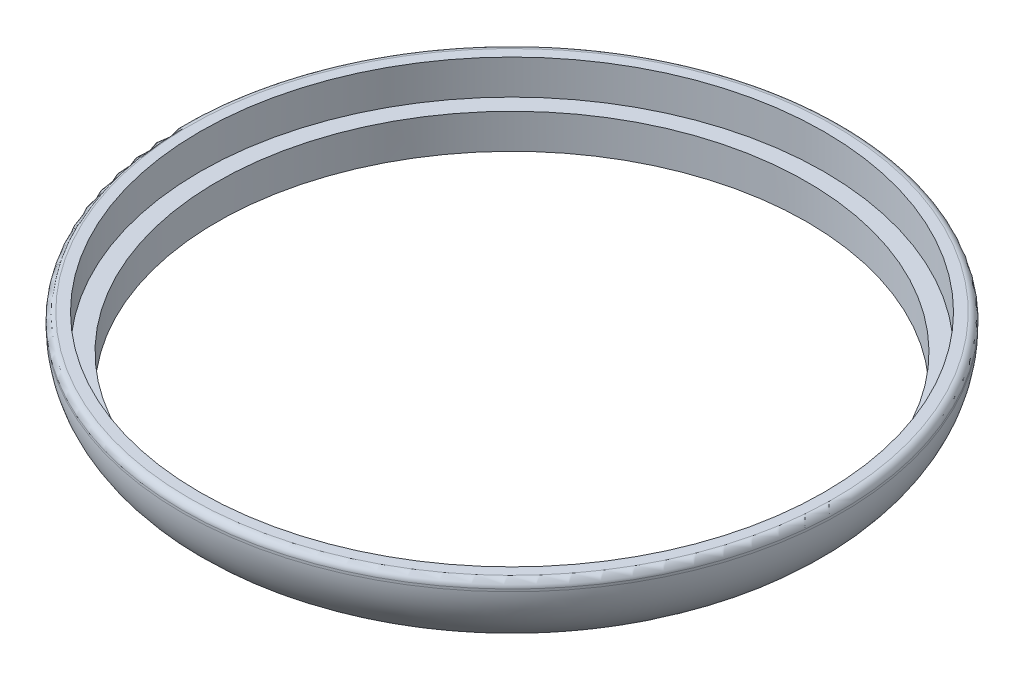
from build123d import *

# Parameters (mm, degrees)
SKETCH1_R           = 4.75
SKETCH1_R_2         = 4.25
BOSS_EXTRUDE1_DEPTH = 1
SKETCH2_R           = 4.5
CUT_EXTRUDE1_DEPTH  = 0.5
FILLET1_R           = 1
FILLET2_R           = 0.1


with BuildPart() as part:
    # Sketch1 → Boss-Extrude1 (new body)
    with BuildSketch(Plane(origin=(0, 0, 0), x_dir=(1, 0, 0), z_dir=(0, 1, 0))):
        with Locations(Location((0, 0, 0), (0, 0, 270))):
            Circle(SKETCH1_R)
        with Locations(Location((0, 0, 0), (0, 0, 270))):
            Circle(SKETCH1_R_2, mode=Mode.SUBTRACT)
    extrude(amount=BOSS_EXTRUDE1_DEPTH)

    # Sketch2 → Cut-Extrude1 (cut)
    with BuildSketch(Plane(origin=(0, 1, 0), x_dir=(1, 0, 0), z_dir=(0, 1, 0))):
        with Locations(Location((0, 0, 0), (0, 0, 270))):
            Circle(SKETCH2_R)
    extrude(amount=-CUT_EXTRUDE1_DEPTH, mode=Mode.SUBTRACT)

    # Fillet1
    # the kernel refuses this fillet: 1 mm, written as the material it takes off along each edge
    with BuildSketch(Plane(origin=(0, 0, 0), x_dir=(0, 0, 1), z_dir=(-1, 0, 0))) as fillet1_piece_1:
        with BuildLine():
            CenterArc((3.75, 0.866025404), FILLET1_R, 300, 60)
            Line((4.25, 0), (4.26, -0.017320508))
            ThreePointArc((4.26, -0.017320508), (4.5, -0.02), (4.75, -0.02))
            Line((4.75, -0.02), (4.77, 0))
            Line((4.77, 0), (4.77, 0.866025404))
            Line((4.77, 0.866025404), (4.75, 0.866025404))
        make_face()
    revolve(axis=Axis((0, 0, 0), (0, 1, 0)), mode=Mode.SUBTRACT)

    # Fillet2
    fillet2_edges = [part.edges().sort_by_distance(p)[0] for p in [
        (0, 1, -4.75),
    ]]
    fillet(fillet2_edges, radius=FILLET2_R)


solid = part.part
